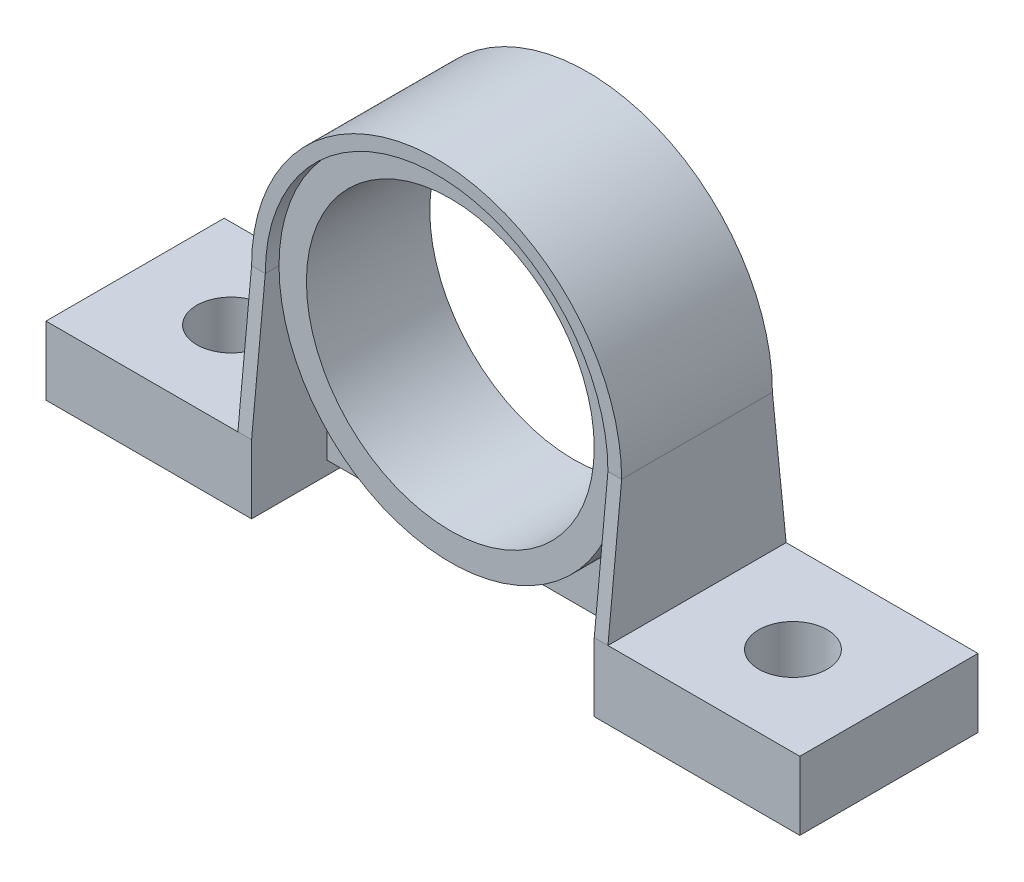
from build123d import *

# Parameters (mm, degrees)
SKETCH1_R                = 12.5
SKETCH1_R_2              = 4
BOSS_EXTRUDE1_DEPTH      = 6.5
CUT_EXTRUDE1_DEPTH       = 5.5
CUT_EXTRUDE2_START       = -5.5
CUT_EXTRUDE2_DEPTH       = 5.5
SKETCH5_R                = 12.5
SKETCH5_R_2              = 10.5
CUT_EXTRUDE3_DEPTH       = 2
CUT_EXTRUDE4_START       = -2
SKETCH6_R                = 12.5
SKETCH6_R_2              = 10.5
CUT_EXTRUDE4_DEPTH       = 2
CUT_EXTRUDE5_START       = -13
SKETCH7_R                = 10.5
CUT_EXTRUDE5_DEPTH       = 13
SKETCH8_R                = 2.5
CUT_EXTRUDE6_DEPTH       = 13
CUT_EXTRUDE7_DEPTH       = 1
CUT_EXTRUDE8_START       = -1
CUT_EXTRUDE8_DEPTH       = 1
CUT_EXTRUDE9_START       = -1
CUT_EXTRUDE9_DEPTH       = 1
CUT_EXTRUDE10_DEPTH      = 45.138985036
CUT_EXTRUDE10_DEPTH_BACK = 1
CUT_EXTRUDE11_START      = -1
CUT_EXTRUDE11_DEPTH      = 1
CUT_EXTRUDE12_DEPTH      = 45.138985036
CUT_EXTRUDE12_DEPTH_BACK = 1


# Read off the part's stored shape, not the designer's step: Cut-Extrude9, Cut-Extrude11
with BuildPart() as part:
    # Sketch1 → Boss-Extrude1 (new, symmetric)
    # profile 1 of 10: a face of its own
    with BuildSketch(Plane.XY):
        Circle(SKETCH1_R)
        with Locations(Location((0, 0, 0), (0, 0, 180))):
            Circle(SKETCH1_R_2, mode=Mode.SUBTRACT)
    # profile 2 of 10: a face of its own
    with BuildSketch(Plane.XY):
        with BuildLine():
            ThreePointArc((-13.5, 0), (-13.247641299, -2.598076211), (-12.5, -5.099019514))
            Line((-12.5, -5.099019514), (-12.5, 0))
            ThreePointArc((-12.5, 0), (0, 12.5), (12.5, 0))
            Line((12.5, 0), (12.5, -5.099019514))
            ThreePointArc((12.5, -5.099019514), (13.247641299, -2.598076211), (13.5, 0))
            ThreePointArc((13.5, 0), (0, 13.5), (-13.5, 0))
        make_face()
    # profile 3 of 10: a face of its own
    with BuildSketch(Plane.XY):
        with BuildLine():
            Line((-12.5, 0), (-12.5, -5.099019514))
            ThreePointArc((-12.5, -5.099019514), (0, -13.5), (12.5, -5.099019514))
            Line((12.5, -5.099019514), (12.5, 0))
            ThreePointArc((12.5, 0), (0, -12.5), (-12.5, 0))
        make_face()
    # profile 4 of 10: a face of its own
    with BuildSketch(Plane.XY):
        with BuildLine():
            ThreePointArc((-13.5, 0), (-13.247641299, -2.598076211), (-12.5, -5.099019514))
            Line((-12.5, -5.099019514), (-12.5, 0))
            ThreePointArc((-12.5, 0), (0, 12.5), (12.5, 0))
            Line((12.5, 0), (12.5, -5.099019514))
            ThreePointArc((12.5, -5.099019514), (13.247641299, -2.598076211), (13.5, 0))
            ThreePointArc((13.5, 0), (0, 13.5), (-13.5, 0))
        make_face()
    # profile 5 of 10: a face of its own
    with BuildSketch(Plane.XY):
        with BuildLine():
            Line((-12.5, 0), (-12.5, -5.099019514))
            ThreePointArc((-12.5, -5.099019514), (0, -13.5), (12.5, -5.099019514))
            Line((12.5, -5.099019514), (12.5, 0))
            ThreePointArc((12.5, 0), (0, -12.5), (-12.5, 0))
        make_face()
    # profile 6 of 10: a face of its own
    with BuildSketch(Plane.XY):
        with BuildLine():
            Line((-13.5, -10), (-12.5, -10))
            Line((-12.5, -10), (-12.5, -5.099019514))
            ThreePointArc((-12.5, -5.099019514), (-13.247641299, -2.598076211), (-13.5, 0))
            Line((-13.5, 0), (-13.5, -10))
        make_face()
    # profile 7 of 10: a face of its own
    with BuildSketch(Plane.XY):
        Polygon((-12.5, -14.03581164), (-12.5, -10), (-13.5, -10), (-27.5, -10), (-27.5, -15), (-12.5, -15), align=None)
    # profile 8 of 10: a face of its own
    with BuildSketch(Plane.XY):
        with BuildLine():
            Line((-12.5, -5.099019514), (-12.5, -10))
            Line((-12.5, -10), (-12.5, -14.03581164))
            Line((-12.5, -14.03581164), (12.5, -14.03581164))
            Line((12.5, -14.03581164), (12.5, -10))
            Line((12.5, -10), (12.5, -5.099019514))
            ThreePointArc((12.5, -5.099019514), (0, -13.5), (-12.5, -5.099019514))
        make_face()
    # profile 9 of 10: a face of its own
    with BuildSketch(Plane.XY):
        Polygon((12.5, -10), (12.5, -14.03581164), (12.5, -15), (27.5, -15), (27.5, -10), (13.5, -10), align=None)
    # profile 10 of 10: a face of its own
    with BuildSketch(Plane.XY):
        with BuildLine():
            ThreePointArc((13.5, 0), (13.247641299, -2.598076211), (12.5, -5.099019514))
            Line((12.5, -5.099019514), (12.5, -10))
            Line((12.5, -10), (13.5, -10))
            Line((13.5, -10), (13.5, 0))
        make_face()
    extrude(amount=BOSS_EXTRUDE1_DEPTH, both=True)

    # Sketch3 → Cut-Extrude1 (cut)
    with BuildSketch(Plane.XY.offset(6.5)):
        with BuildLine():
            Line((-12.5, 0), (-12.5, -14.03581164))
            Line((-12.5, -14.03581164), (12.5, -14.03581164))
            Line((12.5, -14.03581164), (12.5, 0))
            ThreePointArc((12.5, 0), (0, -12.5), (-12.5, 0))
        make_face()
    extrude(amount=-CUT_EXTRUDE1_DEPTH, mode=Mode.SUBTRACT)

    # Sketch4 → Cut-Extrude2 (cut)
    with BuildSketch(Plane(origin=(0, 0, -6.5), x_dir=(-1, 0, 0), z_dir=(0, 0, -1)).offset(CUT_EXTRUDE2_START)):
        with BuildLine():
            Line((-12.5, 0), (-12.5, -14.03581164))
            Line((-12.5, -14.03581164), (12.5, -14.03581164))
            Line((12.5, -14.03581164), (12.5, 0))
            ThreePointArc((12.5, 0), (0, -12.5), (-12.5, 0))
        make_face()
    extrude(amount=CUT_EXTRUDE2_DEPTH, mode=Mode.SUBTRACT)

    # Sketch5 → Cut-Extrude3 (cut)
    with BuildSketch(Plane.XY.offset(6.5)):
        Circle(SKETCH5_R)
        Circle(SKETCH5_R_2, mode=Mode.SUBTRACT)
    extrude(amount=-CUT_EXTRUDE3_DEPTH, mode=Mode.SUBTRACT)

    # Sketch6 → Cut-Extrude4 (cut)
    with BuildSketch(Plane(origin=(0, 0, -6.5), x_dir=(-1, 0, 0), z_dir=(0, 0, -1)).offset(CUT_EXTRUDE4_START)):
        Circle(SKETCH6_R)
        with Locations(Location((0, 0, 0), (0, 0, 180))):
            Circle(SKETCH6_R_2, mode=Mode.SUBTRACT)
    extrude(amount=CUT_EXTRUDE4_DEPTH, mode=Mode.SUBTRACT)

    # Sketch7 → Cut-Extrude5 (cut)
    with BuildSketch(Plane(origin=(0, 0, -6.5), x_dir=(-1, 0, 0), z_dir=(0, 0, -1)).offset(CUT_EXTRUDE5_START)):
        Circle(SKETCH7_R)
    extrude(amount=CUT_EXTRUDE5_DEPTH, mode=Mode.SUBTRACT)

    # Sketch8 → Cut-Extrude6 (cut)
    with BuildSketch(Plane(origin=(0, -10, 0), x_dir=(1, 0, 0), z_dir=(0, 1, 0))):
        with Locations(Location((20.5, 0, 0), (0, 0, 180))):
            Circle(SKETCH8_R)
        with Locations(Location((-20.5, 0, 0), (0, 0, 180))):
            Circle(SKETCH8_R)
    extrude(amount=-CUT_EXTRUDE6_DEPTH, mode=Mode.SUBTRACT)

    # Sketch10 → Cut-Extrude7 (cut)
    with BuildSketch(Plane.XY.offset(6.5)):
        with BuildLine():
            Line((-13.5, 0), (-12.5, 0))
            ThreePointArc((-12.5, 0), (0, 12.5), (12.5, 0))
            Line((12.5, 0), (13.5, 0))
            ThreePointArc((13.5, 0), (0, 13.5), (-13.5, 0))
        make_face()
    extrude(amount=-CUT_EXTRUDE7_DEPTH, mode=Mode.SUBTRACT)

    # Sketch11 → Cut-Extrude8 (cut)
    with BuildSketch(Plane(origin=(0, 0, -6.5), x_dir=(-1, 0, 0), z_dir=(0, 0, -1)).offset(CUT_EXTRUDE8_START)):
        with BuildLine():
            Line((-13.5, 0), (-12.5, 0))
            ThreePointArc((-12.5, 0), (0, 12.5), (12.5, 0))
            Line((12.5, 0), (13.5, 0))
            ThreePointArc((13.5, 0), (0, 13.5), (-13.5, 0))
        make_face()
    extrude(amount=CUT_EXTRUDE8_DEPTH, mode=Mode.SUBTRACT)

    # Cut-Extrude9 outline → Cut-Extrude9 (cut)
    with BuildSketch(Plane(origin=(13.5, 0, 0), x_dir=(0, 0, -1), z_dir=(1, 0, 0)).offset(CUT_EXTRUDE9_START)):
        Polygon((-6.5, 0), (-6.5, -10), (-5.5, 0), align=None)
    extrude(amount=CUT_EXTRUDE9_DEPTH, mode=Mode.SUBTRACT)

    # Sketch13 → Cut-Extrude10 (cut, two sides: drawn at the far end of the back side and taken through both)
    with BuildSketch(Plane(origin=(13.5, 0, 0), x_dir=(0, 0, -1), z_dir=(1, 0, 0)).offset(-CUT_EXTRUDE10_DEPTH_BACK)):
        Polygon((6.5, 0), (5.5, 0), (6.5, -10), align=None)
    extrude(amount=CUT_EXTRUDE10_DEPTH + CUT_EXTRUDE10_DEPTH_BACK, mode=Mode.SUBTRACT)

    # Cut-Extrude11 outline → Cut-Extrude11 (cut)
    with BuildSketch(Plane.ZY.offset(13.5).offset(CUT_EXTRUDE11_START)):
        Polygon((-6.5, 0), (-6.5, -10), (-5.5, 0), align=None)
    extrude(amount=CUT_EXTRUDE11_DEPTH, mode=Mode.SUBTRACT)

    # Sketch15 → Cut-Extrude12 (cut, two sides: drawn at the far end of the back side and taken through both)
    with BuildSketch(Plane.ZY.offset(13.5).offset(-CUT_EXTRUDE12_DEPTH_BACK)):
        Polygon((6.5, 0), (5.5, 0), (6.5, -10), align=None)
    extrude(amount=CUT_EXTRUDE12_DEPTH + CUT_EXTRUDE12_DEPTH_BACK, mode=Mode.SUBTRACT)


solid = part.part
